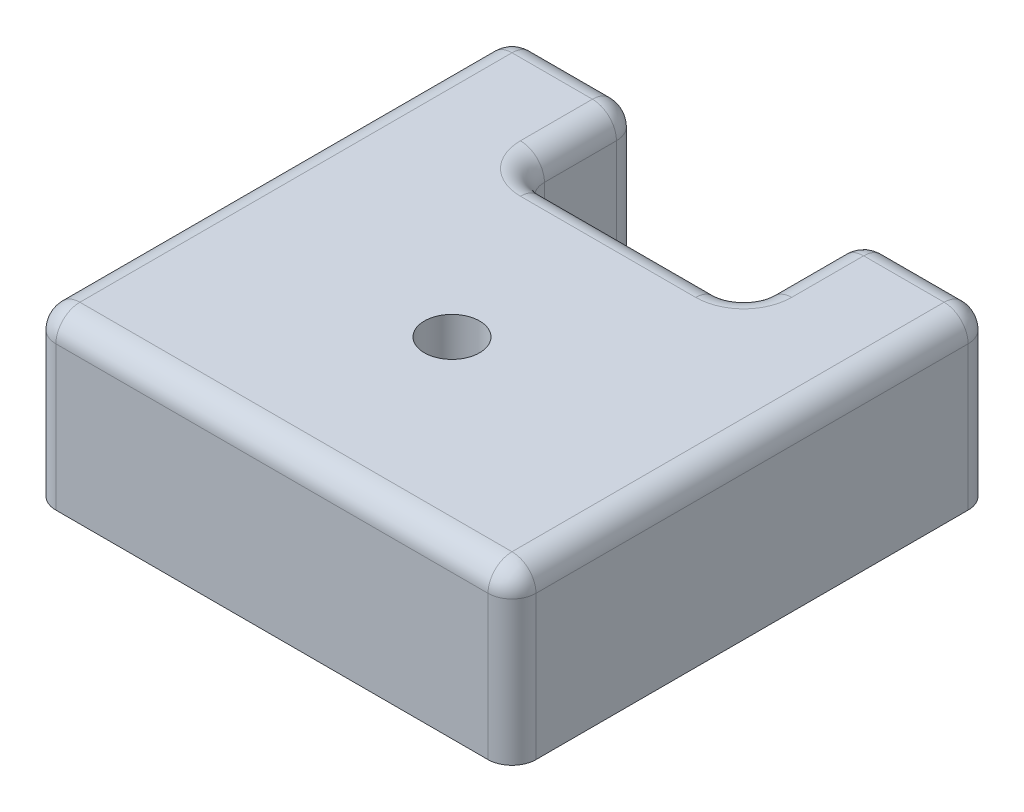
from build123d import *

# Parameters (mm, degrees)
BOSS_EXTRUDE1_DEPTH = 7
FILLET1_R           = 1
SKETCH3_R           = 1.15
CUT_EXTRUDE1_DEPTH  = 30.137604569


with BuildPart() as part:
    # Sketch2 → Boss-Extrude1 (new body)
    with BuildSketch(Plane(origin=(0, 0, 0), x_dir=(1, 0, 0), z_dir=(0, 1, 0))):
        Polygon((14.65, 20), (20, 20), (20, 0), (0, 0), (0, 20), (5.35, 20), (5.35, 15), (14.65, 15), align=None)
    extrude(amount=BOSS_EXTRUDE1_DEPTH)

    # Fillet1
    fillet1_edges = [part.edges().sort_by_distance(p)[0] for p in [
        (0, 7, -10),
        (2.675, 7, -20),
        (5.35, 7, -17.5),
        (10, 7, -15),
        (14.65, 7, -17.5),
        (17.325, 7, -20),
        (20, 7, -10),
        (10, 7, 0),
        (0, 3.5, 0),
        (20, 3.5, 0),
        (20, 3.5, -20),
        (0, 3.5, -20),
        (14.65, 3.5, -20),
        (14.65, 3.5, -15),
        (5.35, 3.5, -15),
        (5.35, 3.5, -20),
    ]]
    fillet(fillet1_edges, radius=FILLET1_R)

    # Sketch3 → Cut-Extrude1 (cut, through all)
    with BuildSketch(Plane(origin=(0, 7, 0), x_dir=(1, 0, 0), z_dir=(0, 1, 0))):
        with Locations((10, 7.5)):
            Circle(SKETCH3_R)
    extrude(amount=-CUT_EXTRUDE1_DEPTH, mode=Mode.SUBTRACT)


solid = part.part
